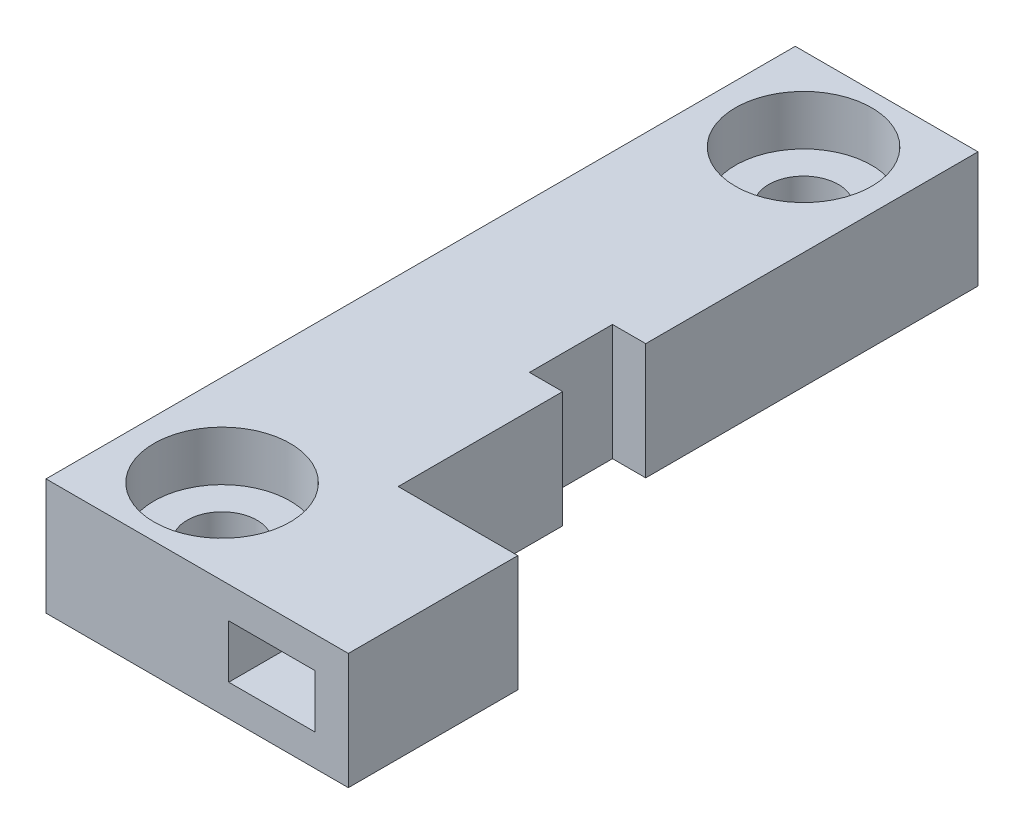
from build123d import *

# Parameters (mm, degrees)
BOSS_EXTRUDE1_DEPTH = 7
CUT_EXTRUDE1_REACH  = 51.135
SKETCH2_W           = 5.2
SKETCH2_H           = 3.2
CUT_EXTRUDE2_REACH  = 51.135
SKETCH3_R           = 2.1
SKETCH4_R           = 4.1
CUT_EXTRUDE3_DEPTH  = 3


with BuildPart() as part:
    # Sketch1 → Boss-Extrude1 (new body)
    with BuildSketch(Plane(origin=(0, 0, 0), x_dir=(1, 0, 0), z_dir=(0, 1, 0))):
        Polygon((0, 0), (18.2, 0), (18.2, 10.2), (11, 10.2), (11, 20.1), (9, 20.1), (9, 25.1), (11, 25.1), (11, 45.1), (0, 45.1), align=None)
    extrude(amount=BOSS_EXTRUDE1_DEPTH)

    # Sketch2 → Cut-Extrude1 (cut, up to next)
    with BuildSketch(Plane.XY, mode=Mode.PRIVATE) as cut_extrude1_sk1:
        with Locations((13.6, 3.5)):
            Rectangle(SKETCH2_W, SKETCH2_H)
    cut_extrude1_tool1 = extrude(cut_extrude1_sk1.sketch, amount=-CUT_EXTRUDE1_REACH, mode=Mode.PRIVATE) & part.part
    add(cut_extrude1_tool1.solids().sort_by_distance((13.6, 3.5, 0))[0], mode=Mode.SUBTRACT)

    # Sketch3 → Cut-Extrude2 (cut, up to next)
    with BuildSketch(Plane(origin=(0, 7, 0), x_dir=(1, 0, 0), z_dir=(0, 1, 0)), mode=Mode.PRIVATE) as cut_extrude2_sk1:
        with Locations((5.5, 5.1)):
            Circle(SKETCH3_R)
    cut_extrude2_tool1 = extrude(cut_extrude2_sk1.sketch, amount=-CUT_EXTRUDE2_REACH, mode=Mode.PRIVATE) & part.part
    # Sketch3 → Cut-Extrude2 (cut, up to next)
    with BuildSketch(Plane(origin=(0, 7, 0), x_dir=(1, 0, 0), z_dir=(0, 1, 0)), mode=Mode.PRIVATE) as cut_extrude2_sk2:
        with Locations((5.5, 40.1)):
            Circle(SKETCH3_R)
    cut_extrude2_tool2 = extrude(cut_extrude2_sk2.sketch, amount=-CUT_EXTRUDE2_REACH, mode=Mode.PRIVATE) & part.part
    add(cut_extrude2_tool1.solids().sort_by_distance((5.5, 7, -5.1))[0], mode=Mode.SUBTRACT)
    add(cut_extrude2_tool2.solids().sort_by_distance((5.5, 7, -40.1))[0], mode=Mode.SUBTRACT)

    # Sketch4 → Cut-Extrude3 (cut)
    with BuildSketch(Plane(origin=(0, 7, 0), x_dir=(1, 0, 0), z_dir=(0, 1, 0))):
        with Locations((5.5, 5.1)):
            Circle(SKETCH4_R)
        with Locations((5.5, 40.1)):
            Circle(SKETCH4_R)
    extrude(amount=-CUT_EXTRUDE3_DEPTH, mode=Mode.SUBTRACT)


solid = part.part
